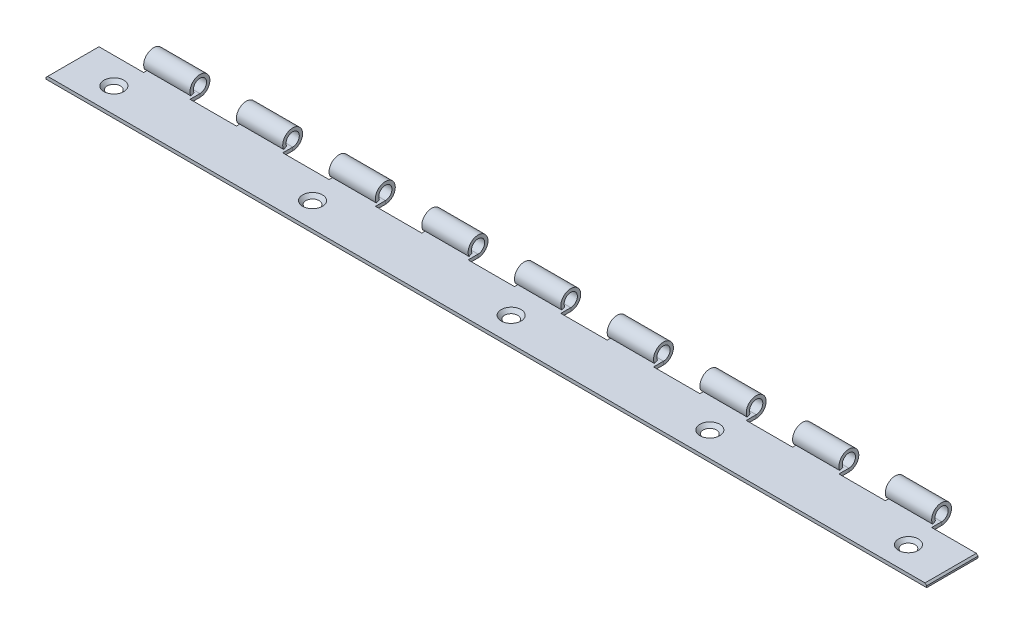
from build123d import *

# Parameters (mm, degrees)
SKETCH1_W          = 266
SKETCH1_H          = 25.5
BASE_FLANGE1_DEPTH = 1
HEM1_START         = -133
HEM1_DEPTH         = 266
HEM1_2_DEPTH       = 266
CUT_EXTRUDE1_START = -134.703262862
SKETCH8_W          = 14
SKETCH8_H          = 6
CUT_EXTRUDE1_DEPTH = 259.406525724
LPATTERN1_COUNT    = 11
LPATTERN1_PITCH    = 28
CHAMFER1_SIZE      = 0.5
SKETCH10_W         = 266
SKETCH10_H         = 4
CUT_EXTRUDE3_DEPTH = 10
SKETCH9_R          = 2
CUT_EXTRUDE2_DEPTH = 10
LPATTERN2_COUNT    = 5
LPATTERN2_PITCH    = 60
CHAMFER2_SIZE      = 1


# Read off the part's stored shape, not the designer's step: Hem1
# Sheet-metal steps are written as plain solids
with BuildPart() as part:
    # Sketch1 → Base-Flange1 (new body)
    with BuildSketch(Plane(origin=(0, 0, 0), x_dir=(1, 0, 0), z_dir=(0, 1, 0))):
        Rectangle(SKETCH1_W, SKETCH1_H)
    extrude(amount=-BASE_FLANGE1_DEPTH)

    # Hem1 outline → Hem1 (cut)
    with BuildSketch(Plane.YZ.offset(HEM1_START)):
        with BuildLine():
            Line((0, -12.75), (0, -11.986067977))
            ThreePointArc((0, -11.986067977), (-0.738612788, -10.974744871), (-1, -9.75))
            Line((-1, -9.75), (-1, -12.75))
            Line((-1, -12.75), (0, -12.75))
        make_face()
    extrude(amount=HEM1_DEPTH, mode=Mode.SUBTRACT)

    # Hem1 2 outline → Hem1 2 (add)
    with BuildSketch(Plane.YZ.offset(HEM1_START)):
        with BuildLine():
            Line((0.732145215, -7.031076639), (1.154763477, -7.937384426))
            ThreePointArc((1.154763477, -7.937384426), (3.686782892, -10.824599218), (0, -9.75))
            Line((0, -9.75), (0, -11.986067977))
            ThreePointArc((0, -11.986067977), (4.967777538, -10.18851623), (0.732145215, -7.031076639))
        make_face()
    extrude(amount=HEM1_2_DEPTH)

    # Sketch8 → Cut-Extrude1 (cut)
    with BuildSketch(Plane(origin=(0, 0, 0), x_dir=(1, 0, 0), z_dir=(0, 1, 0)).offset(CUT_EXTRUDE1_START)):
        with Locations((126, 9.75)):
            Rectangle(SKETCH8_W, SKETCH8_H)
    cut_extrude1 = extrude(amount=CUT_EXTRUDE1_DEPTH, mode=Mode.SUBTRACT)

    # LPattern1: Cut-Extrude1 ×11
    with Locations(*[(-i * LPATTERN1_PITCH, 0, 0) for i in range(1, LPATTERN1_COUNT)]):
        add(cut_extrude1, mode=Mode.SUBTRACT)

    # Chamfer1
    chamfer1_edges = [part.edges().sort_by_distance(p)[0] for p in [
        (-133, 0, 3),
        (0, 0, 12.75),
        (133, 0, 3),
    ]]
    chamfer(chamfer1_edges, length=CHAMFER1_SIZE)

    # Sketch10 → Cut-Extrude3 (cut)
    with BuildSketch(Plane(origin=(0, 0, 0), x_dir=(1, 0, 0), z_dir=(0, 1, 0))):
        with Locations((0, -10.75)):
            Rectangle(SKETCH10_W, SKETCH10_H)
    extrude(amount=-CUT_EXTRUDE3_DEPTH, mode=Mode.SUBTRACT)

    # Sketch9 → Cut-Extrude2 (cut)
    with BuildSketch(Plane(origin=(0, 0, 0), x_dir=(1, 0, 0), z_dir=(0, 1, 0))):
        with Locations(Location((-120, -1.25, 0), (0, 0, 270))):
            Circle(SKETCH9_R)
    cut_extrude2 = extrude(amount=-CUT_EXTRUDE2_DEPTH, mode=Mode.SUBTRACT)

    # LPattern2: Cut-Extrude2 ×5
    with Locations(*[(i * LPATTERN2_PITCH, 0, 0) for i in range(1, LPATTERN2_COUNT)]):
        add(cut_extrude2, mode=Mode.SUBTRACT)

    # Chamfer2
    chamfer2_edges = [part.edges().sort_by_distance(p)[0] for p in [
        (-120, 0, -0.75),
        (-60, 0, -0.75),
        (0, 0, -0.75),
        (60, 0, -0.75),
        (120, 0, -0.75),
    ]]
    chamfer(chamfer2_edges, length=CHAMFER2_SIZE - 0.0001)  # a hair under: the kernel refuses the full size


solid = part.part
